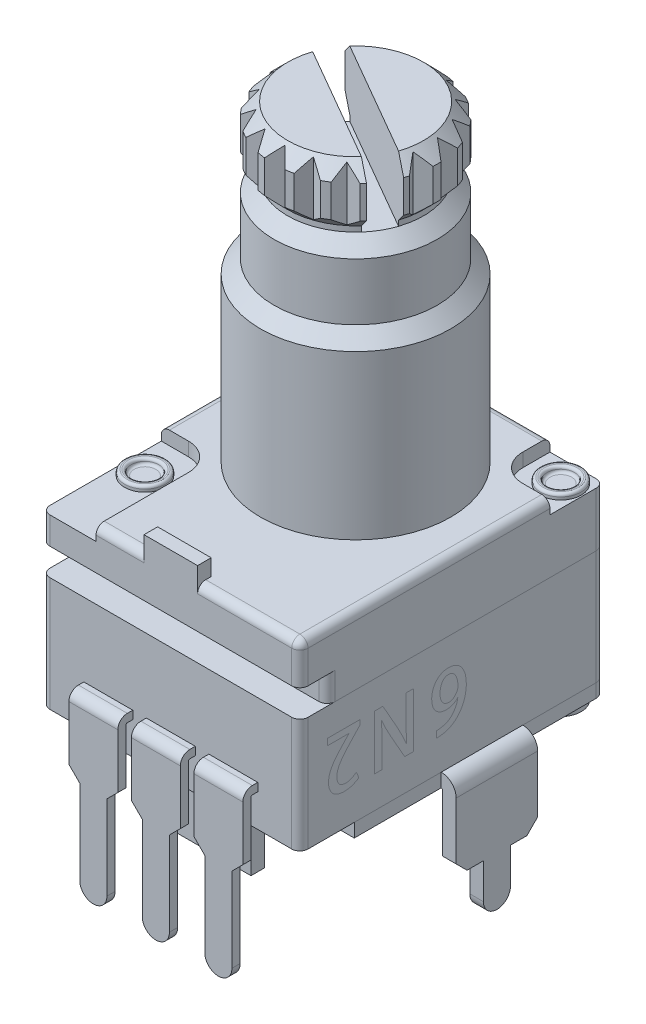
from build123d import *

# Parameters (mm, degrees)
SKETCH1_W               = 9.5
SKETCH1_H               = 11.2
BOSS_EXTRUDE1_DEPTH     = 7.2
SKETCH2_R               = 3.5
BOSS_EXTRUDE2_DEPTH     = 6.5
SKETCH3_R               = 3
BOSS_EXTRUDE3_DEPTH     = 5
CHAMFER1_SIZE           = 0.5
SKETCH5_W               = 1.8
SKETCH5_H               = 0.3
BOSS_EXTRUDE5_DEPTH     = 0.2
SKETCH7_W               = 1.8
SKETCH7_H               = 0.3
SKETCH8_W               = 1.8
SKETCH8_H               = 0.3
BOSS_EXTRUDE6_DEPTH     = 2
SKETCH9_W               = 1
SKETCH9_H               = 0.3
BOSS_EXTRUDE7_DEPTH     = 4
SKETCH10_W              = 3
SKETCH10_H              = 0.5
SKETCH12_W              = 0.5
SKETCH12_H              = 3
BOSS_EXTRUDE8_DEPTH     = 2.5
SKETCH14_W              = 0.5
SKETCH14_H              = 1
BOSS_EXTRUDE9_DEPTH     = 1.8
SKETCH15_W              = 3
SKETCH15_H              = 0.5
FILLET1_R               = 0.5
CHAMFER2_SIZE           = 0.4
SKETCH17_W              = 3
SKETCH17_H              = 0.5
BOSS_EXTRUDE10_DEPTH    = 2.5
SKETCH18_W              = 9.5
SKETCH18_H              = 0.5
CUT_EXTRUDE2_DEPTH      = 2
SKETCH20_W              = 9.5
SKETCH20_H              = 1
CUT_EXTRUDE3_DEPTH      = 1
SKETCH22_W              = 1.97
SKETCH22_H              = 0.5
BOSS_EXTRUDE11_DEPTH    = 0.6
CHAMFER4_SIZE           = 0.5
CUT_EXTRUDE4_DEPTH      = 15.117896444
CUT_EXTRUDE4_DEPTH_BACK = 0.5
SKETCH25_R              = 0.75
SKETCH25_R_2            = 0.5
BOSS_EXTRUDE12_DEPTH    = 0.2
FILLET2_R               = 0.1
BOSS_EXTRUDE13_START    = 0.2
SKETCH27_R              = 0.75
BOSS_EXTRUDE13_DEPTH    = 0.2
FILLET3_R               = 0.3
CUT_SWEEP9_PITCH        = 0.4
CUT_SWEEP9_HEIGHT       = 5.2
CUT_SWEEP9_RADIUS       = 3.875
CUT_EXTRUDE5_START      = -2.2
SKETCH39_OUTSIDE_W      = 18.238
SKETCH39_OUTSIDE_H      = 19.938
SKETCH39_OUTSIDE_R      = 2.5
CUT_EXTRUDE5_DEPTH      = 0.2
CHAMFER5_SIZE           = 0.5
CUT_EXTRUDE6_DEPTH      = 2.4
CIRPATTERN1_COUNT       = 18
CUT_EXTRUDE7_DEPTH      = 2.4


with BuildPart() as part:
    # Sketch1 → Boss-Extrude1 (new body)
    with BuildSketch(Plane(origin=(0, 0, 0), x_dir=(1, 0, 0), z_dir=(0, 1, 0))):
        Rectangle(SKETCH1_W, SKETCH1_H)
    extrude(amount=BOSS_EXTRUDE1_DEPTH)

    # Sketch2 → Boss-Extrude2 (add)
    with BuildSketch(Plane(origin=(0, 7.2, 0), x_dir=(1, 0, 0), z_dir=(0, 1, 0))):
        with Locations(Location((0, 1.2, 0), (0, 0, 90))):
            Circle(SKETCH2_R)
    extrude(amount=BOSS_EXTRUDE2_DEPTH)

    # Sketch3 → Boss-Extrude3 (add)
    with BuildSketch(Plane(origin=(0, 13.7, 0), x_dir=(1, 0, 0), z_dir=(0, 1, 0))):
        with Locations(Location((0, 1.2, 0), (0, 0, 270))):
            Circle(SKETCH3_R)
    extrude(amount=BOSS_EXTRUDE3_DEPTH)

    # Chamfer1
    chamfer1_edges = [part.edges().sort_by_distance(p)[0] for p in [
        (0, 18.7, -4.2),
    ]]
    chamfer(chamfer1_edges, length=CHAMFER1_SIZE)

    # Sketch5 → Boss-Extrude5 (add)
    with BuildSketch(Plane.XY.offset(5.6)):
        with Locations((-2.3, 1.85)):
            Rectangle(SKETCH5_W, SKETCH5_H)
        with Locations((0, 1.85)):
            Rectangle(SKETCH5_W, SKETCH5_H)
        with Locations((2.3, 1.85)):
            Rectangle(SKETCH5_W, SKETCH5_H)
    extrude(amount=BOSS_EXTRUDE5_DEPTH)

    # Sweep1: sweep along a path in Sketch6
    with BuildLine(Plane(origin=(0, 0, 0), x_dir=(0, 0, -1), z_dir=(1, 0, 0))) as sweep1_path:
        ThreePointArc((-5.8, 1.7), (-5.835355339, 1.685355339), (-5.85, 1.65))
    # Sketch7 → Sweep1 (sweep)
    with BuildSketch(Plane.XY.offset(5.8)):
        with Locations((-2.3, 1.85)):
            Rectangle(SKETCH7_W, SKETCH7_H)
        with Locations((0, 1.85)):
            Rectangle(SKETCH7_W, SKETCH7_H)
        with Locations((2.3, 1.85)):
            Rectangle(SKETCH7_W, SKETCH7_H)
    sweep(path=sweep1_path.line)

    # Sketch8 → Boss-Extrude6 (add)
    with BuildSketch(Plane.XZ.offset(-1.65)):
        with Locations((-2.3, 6)):
            Rectangle(SKETCH8_W, SKETCH8_H)
        with Locations((0, 6)):
            Rectangle(SKETCH8_W, SKETCH8_H)
        with Locations((2.3, 6)):
            Rectangle(SKETCH8_W, SKETCH8_H)
    extrude(amount=BOSS_EXTRUDE6_DEPTH)

    # Sketch9 → Boss-Extrude7 (add)
    with BuildSketch(Plane.XZ.offset(0.35)):
        with Locations((-2.3, 6)):
            Rectangle(SKETCH9_W, SKETCH9_H)
        with Locations((0, 6)):
            Rectangle(SKETCH9_W, SKETCH9_H)
        with Locations((2.3, 6)):
            Rectangle(SKETCH9_W, SKETCH9_H)
    extrude(amount=BOSS_EXTRUDE7_DEPTH)

    # Sweep2: sweep along a path in Sketch11
    with BuildLine(Plane.XY) as sweep2_path:
        ThreePointArc((-4.75, 0), (-4.785355339, -0.014644661), (-4.8, -0.05))
    # Sketch10 → Sweep2 (sweep)
    with BuildSketch(Plane.ZY.offset(4.75)):
        with Locations((-1.1, 0.25)):
            Rectangle(SKETCH10_W, SKETCH10_H)
    sweep2 = sweep(path=sweep2_path.line)

    # Sketch12 → Boss-Extrude8 (add)
    with BuildSketch(Plane.XZ.offset(0.05)):
        with Locations((-5.05, -1.1)):
            Rectangle(SKETCH12_W, SKETCH12_H)
    boss_extrude8 = extrude(amount=BOSS_EXTRUDE8_DEPTH)

    # Sketch14 → Boss-Extrude9 (add)
    with BuildSketch(Plane.XZ.offset(2.55)):
        with Locations((-5.05, -1.1)):
            Rectangle(SKETCH14_W, SKETCH14_H)
    boss_extrude9 = extrude(amount=BOSS_EXTRUDE9_DEPTH)

    # Mirror1: Sweep2, Boss-Extrude8, Boss-Extrude9 across plane
    add(sweep2.mirror(Plane(origin=(0, 0, 0), x_dir=(0, 0, 1), z_dir=(1, 0, 0))))
    add(boss_extrude8.mirror(Plane(origin=(0, 0, 0), x_dir=(0, 0, 1), z_dir=(1, 0, 0))))
    add(boss_extrude9.mirror(Plane(origin=(0, 0, 0), x_dir=(0, 0, 1), z_dir=(1, 0, 0))))

    # Sweep3: sweep along a path in Sketch16
    with BuildLine(Plane(origin=(0, 0, 0), x_dir=(0, 0, -1), z_dir=(1, 0, 0))) as sweep3_path:
        ThreePointArc((5.65, -0.05), (5.635355339, -0.014644661), (5.6, 0))
    # Sketch15 → Sweep3 (sweep)
    with BuildSketch(Plane(origin=(0, 0, -5.6), x_dir=(-1, 0, 0), z_dir=(0, 0, -1))):
        with Locations((0, 0.25)):
            Rectangle(SKETCH15_W, SKETCH15_H)
    sweep3 = sweep(path=sweep3_path.line)

    # Fillet1
    fillet1_edges = [part.edges().sort_by_distance(p)[0] for p in [
        (2.8, -4.35, 6),
        (1.8, -4.35, 6),
        (0.5, -4.35, 6),
        (-0.5, -4.35, 6),
        (-1.8, -4.35, 6),
        (-2.8, -4.35, 6),
        (-5.05, -4.35, -0.6),
        (-5.05, -4.35, -1.6),
        (5.05, -4.35, -0.6),
        (5.05, -4.35, -1.6),
    ]]
    fillet(fillet1_edges, radius=FILLET1_R - 0.0001)  # a hair under: the kernel refuses the full size

    # Chamfer2
    chamfer2_edges = [part.edges().sort_by_distance(p)[0] for p in [
        (1.8, -0.35, 6),
        (2.8, -0.35, 6),
        (0.5, -0.35, 6),
        (-0.5, -0.35, 6),
        (-1.8, -0.35, 6),
        (-2.8, -0.35, 6),
        (-5.05, -2.55, 0.4),
        (-5.05, -2.55, -2.6),
        (5.05, -2.55, -2.6),
        (5.05, -2.55, 0.4),
    ]]
    chamfer(chamfer2_edges, length=CHAMFER2_SIZE - 0.0001)  # a hair under: the kernel refuses the full size

    # Sketch17 → Boss-Extrude10 (add)
    with BuildSketch(Plane.XZ.offset(0.05)):
        with Locations((0, -5.9)):
            Rectangle(SKETCH17_W, SKETCH17_H)
    boss_extrude10 = extrude(amount=BOSS_EXTRUDE10_DEPTH)

    # Sketch18 → Cut-Extrude2 (cut)
    with BuildSketch(Plane.XY.offset(5.6)):
        with Locations((0, 0.25)):
            Rectangle(SKETCH18_W, SKETCH18_H)
    extrude(amount=-CUT_EXTRUDE2_DEPTH, mode=Mode.SUBTRACT)

    # Mirror2: Sweep3, Boss-Extrude10 across plane
    add(sweep3.mirror(Plane.XY.offset(-1)))
    add(boss_extrude10.mirror(Plane.XY.offset(-1)))

    # Sketch20 → Cut-Extrude3 (cut)
    with BuildSketch(Plane.XY.offset(5.6)):
        with Locations((0, 5.2)):
            Rectangle(SKETCH20_W, SKETCH20_H)
    extrude(amount=-CUT_EXTRUDE3_DEPTH, mode=Mode.SUBTRACT)

    # Sketch22 → Boss-Extrude11 (add)
    with BuildSketch(Plane(origin=(0, 7.2, 0), x_dir=(1, 0, 0), z_dir=(0, 1, 0))):
        with Locations((0, -5.35)):
            Rectangle(SKETCH22_W, SKETCH22_H)
    extrude(amount=BOSS_EXTRUDE11_DEPTH)

    # Chamfer4
    chamfer4_edges = [part.edges().sort_by_distance(p)[0] for p in [
        (0, 13.7, 2.3),
    ]]
    chamfer(chamfer4_edges, length=CHAMFER4_SIZE - 0.0001)  # a hair under: the kernel refuses the full size

    # Sketch23 → Cut-Extrude4 (cut, two sides: drawn at the far end of the back side and taken through both)
    with BuildSketch(Plane(origin=(0, 7.2, 0), x_dir=(1, 0, 0), z_dir=(0, 1, 0)).offset(-CUT_EXTRUDE4_DEPTH_BACK)):
        with BuildLine():
            Line((4.75, 5.6), (2.75, 5.6))
            Line((2.75, 5.6), (2.75, 4.6))
            ThreePointArc((2.75, 4.6), (3.042893219, 3.892893219), (3.75, 3.6))
            Line((3.75, 3.6), (4.75, 3.6))
            Line((4.75, 3.6), (4.75, 5.6))
        make_face()
        with BuildLine():
            Line((-4.75, -5.6), (-2.75, -5.6))
            Line((-2.75, -5.6), (-2.75, -2.2))
            ThreePointArc((-2.75, -2.2), (-3.042893219, -1.492893219), (-3.75, -1.2))
            Line((-3.75, -1.2), (-4.75, -1.2))
            Line((-4.75, -1.2), (-4.75, -5.6))
        make_face()
    extrude(amount=CUT_EXTRUDE4_DEPTH + CUT_EXTRUDE4_DEPTH_BACK, mode=Mode.SUBTRACT)

    # Sketch25 → Boss-Extrude12 (add)
    # profile 1 of 2: a face of its own
    with BuildSketch(Plane(origin=(0, 6.7, 0), x_dir=(1, 0, 0), z_dir=(0, 1, 0))):
        with Locations(Location((3.95, 4.8, 0), (0, 0, 90))):
            Circle(SKETCH25_R)
        with Locations(Location((3.95, 4.8, 0), (0, 0, 270))):
            Circle(SKETCH25_R_2, mode=Mode.SUBTRACT)
    # profile 2 of 2: a face of its own
    with BuildSketch(Plane(origin=(0, 6.7, 0), x_dir=(1, 0, 0), z_dir=(0, 1, 0))):
        with Locations(Location((-3.95, -2.6, 0), (0, 0, 90))):
            Circle(SKETCH25_R)
        with Locations(Location((-3.95, -2.6, 0), (0, 0, 270))):
            Circle(SKETCH25_R_2, mode=Mode.SUBTRACT)
    extrude(amount=BOSS_EXTRUDE12_DEPTH)

    # Fillet2
    fillet2_edges = [part.edges().sort_by_distance(p)[0] for p in [
        (3.95, 6.9, -4.05),
        (3.95, 6.7, -5.3),
        (3.95, 6.9, -5.3),
        (-3.95, 6.9, 3.35),
        (-3.95, 6.7, 2.1),
        (-3.95, 6.9, 2.1),
    ]]
    fillet(fillet2_edges, radius=FILLET2_R - 0.0001)  # a hair under: the kernel refuses the full size

    # Sketch27 → Boss-Extrude13 (add)
    with BuildSketch(Plane.XZ.offset(BOSS_EXTRUDE13_START)):
        with Locations(Location((-3.95, 2.6, 0), (0, 0, 270))):
            Circle(SKETCH27_R)
        with Locations(Location((3.95, -4.8, 0), (0, 0, 270))):
            Circle(SKETCH27_R)
    extrude(amount=-BOSS_EXTRUDE13_DEPTH)

    # Fillet3
    fillet3_edges = [part.edges().sort_by_distance(p)[0] for p in [
        (-4.75, 3.6, -5.6),
        (-4.75, 3.6, -5.6),
        (4.75, 3.35, -5.6),
        (4.75, 3.35, -5.6),
        (-4.75, 5.2, 4.6),
        (4.75, 5.2, 4.6),
        (-4.75, 7.2, -2.2),
        (-1, 7.2, -5.6),
        (4.75, 7.2, 1),
        (2.8675, 7.2, 5.6),
        (-1.8675, 7.2, 5.6),
        (-4.75, 3.6, -5.6),
        (4.75, 3.35, -5.6),
        (4.75, 2.6, 5.6),
        (4.75, 6.45, 5.6),
        (-4.75, 6.2, 5.6),
        (-4.75, 2.6, 5.6),
    ]]
    fillet(fillet3_edges, radius=FILLET3_R)

    # Cut-Sweep9: sweep along a helix
    with BuildLine() as cut_sweep9_path:
        Helix(CUT_SWEEP9_PITCH, CUT_SWEEP9_HEIGHT, CUT_SWEEP9_RADIUS, center=(0, 7.45, -1.2), direction=(0, 1, 0), lefthand=True)
    # Sketch35 → Cut-Sweep9 (sweep, cut)
    with BuildSketch(Plane(origin=(0, 0, 0), x_dir=(0, 0, -1), z_dir=(1, 0, 0))):
        Polygon((-2.675, 7.45), (-3.775, 7.675), (-3.775, 7.225), align=None)
    sweep(path=cut_sweep9_path.line, is_frenet=True, mode=Mode.SUBTRACT)

    # Sketch39 outside → Cut-Extrude5 (cut)
    with BuildSketch(Plane(origin=(0, 18.7, 0), x_dir=(1, 0, 0), z_dir=(0, 1, 0)).offset(CUT_EXTRUDE5_START)):
        Rectangle(SKETCH39_OUTSIDE_W, SKETCH39_OUTSIDE_H)
        with Locations(Location((0, 1.2, 0), (0, 0, 270))):
            Circle(SKETCH39_OUTSIDE_R, mode=Mode.SUBTRACT)
    extrude(amount=-CUT_EXTRUDE5_DEPTH, mode=Mode.SUBTRACT)

    # Chamfer5
    chamfer5_edges = [part.edges().sort_by_distance(p)[0] for p in [
        (0, 16.5, -4.2),
        (0, 16.3, -4.2),
    ]]
    chamfer(chamfer5_edges, length=CHAMFER5_SIZE - 0.0001)  # a hair under: the kernel refuses the full size

    # Sketch40 → Cut-Extrude6 (cut)
    with BuildSketch(Plane(origin=(0, 18.7, 0), x_dir=(1, 0, 0), z_dir=(0, 1, 0))):
        Polygon((0, 3.8), (-0.4, 4.2), (0.4, 4.2), align=None)
    cut_extrude6 = extrude(amount=-CUT_EXTRUDE6_DEPTH, mode=Mode.SUBTRACT)

    # CirPattern1: Cut-Extrude6 ×18 about axis
    cirpattern1_axis = Axis((0, 0, -1.2), (0, 1, 0))
    for i in range(1, CIRPATTERN1_COUNT):
        add(cut_extrude6.rotate(cirpattern1_axis, i * 360 / CIRPATTERN1_COUNT), mode=Mode.SUBTRACT)

    # Sketch42 → Cut-Extrude7 (cut)
    with BuildSketch(Plane(origin=(0, 18.7, 0), x_dir=(1, 0, 0), z_dir=(0, 1, 0))):
        Polygon((-3.031088913, 2.95), (-2.781088913, 3.383012702), (3.281088913, -0.116987298), (3.031088913, -0.55), (2.781088913, -0.983012702), (-3.281088913, 2.516987298), align=None)
    extrude(amount=-CUT_EXTRUDE7_DEPTH, mode=Mode.SUBTRACT)


solid = part.part
